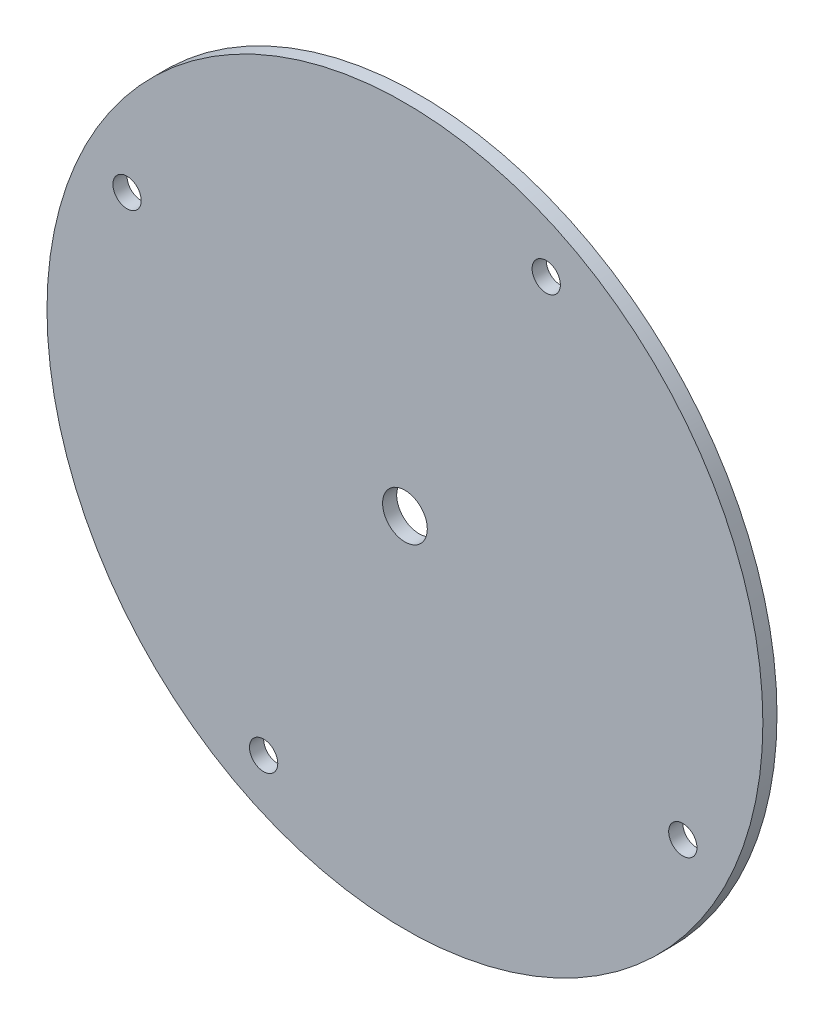
from build123d import *

# Parameters (mm, degrees)
SKETCH1_R           = 76
SKETCH1_R_2         = 3
BOSS_EXTRUDE3_DEPTH = 3
SKETCH2_R           = 4.75
CUT_EXTRUDE1_DEPTH  = 108.522090753


with BuildPart() as part:
    # Sketch1 → Boss-Extrude3 (new body)
    with BuildSketch(Plane.XY):
        Circle(SKETCH1_R)
        with Locations((30, 59)):
            Circle(SKETCH1_R_2, mode=Mode.SUBTRACT)
        with Locations((-30, -59)):
            Circle(SKETCH1_R_2, mode=Mode.SUBTRACT)
        with Locations((59, -30)):
            Circle(SKETCH1_R_2, mode=Mode.SUBTRACT)
        with Locations((-59, 30)):
            Circle(SKETCH1_R_2, mode=Mode.SUBTRACT)
    extrude(amount=BOSS_EXTRUDE3_DEPTH)

    # Sketch2 → Cut-Extrude1 (cut, through all)
    with BuildSketch(Plane.XY.offset(3)):
        Circle(SKETCH2_R)
    extrude(amount=-CUT_EXTRUDE1_DEPTH, mode=Mode.SUBTRACT)


solid = part.part
